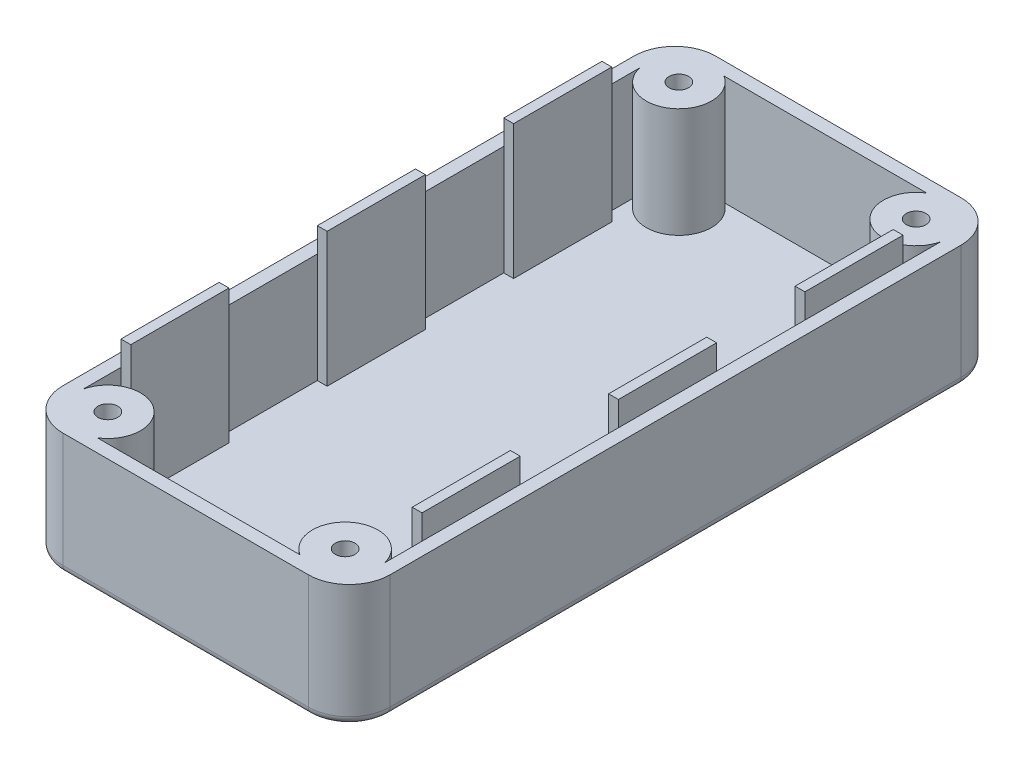
from build123d import *

# Parameters (mm, degrees)
BASE_SKETCH_W            = 40
BASE_SKETCH_H            = 79.79
BASE_DEPTH               = 15
CORNER_ROUNDS_R5_R       = 5
SHELL_T                  = -1.6
SKETCH2_R                = 4
SCREW_BOSSES_DEPTH       = 15
SKETCH3_W                = 1.2
SKETCH3_H                = 12
ALIGNMENT_TABS_DEPTH     = 18
BOTTOM_EDGE_ROUND_R1_R   = 1
SKETCH4_R                = 1.2
M2_CLEARANCE_HOLES_DEPTH = 92.051875961
SKETCH5_R                = 2.2
M2_COUNTERBORES_DEPTH    = 11


with BuildPart() as part:
    # Base Sketch → Base (new body)
    with BuildSketch(Plane(origin=(0, 0, 0), x_dir=(1, 0, 0), z_dir=(0, 1, 0))):
        with Locations((20, 39.895)):
            Rectangle(BASE_SKETCH_W, BASE_SKETCH_H)
    extrude(amount=BASE_DEPTH)

    # Corner Rounds R5
    corner_rounds_r5_edges = [part.edges().sort_by_distance(p)[0] for p in [
        (0, 7.5, -79.79),
        (40, 7.5, -79.79),
        (40, 7.5, 0),
        (0, 7.5, 0),
    ]]
    fillet(corner_rounds_r5_edges, radius=CORNER_ROUNDS_R5_R)

    # Shell
    shell_openings = [part.faces().sort_by_distance(p)[0] for p in [
        (20, 15, -39.895),
    ]]
    offset(amount=SHELL_T, openings=shell_openings, kind=Kind.INTERSECTION)

    # Sketch2 → Screw Bosses (add)
    with BuildSketch(Plane(origin=(0, 0, 0), x_dir=(1, 0, 0), z_dir=(0, 1, 0))):
        with Locations((5.5, 5)):
            Circle(SKETCH2_R)
        with Locations((34.5, 5)):
            Circle(SKETCH2_R)
        with Locations((5.5, 74.79)):
            Circle(SKETCH2_R)
        with Locations((34.5, 74.79)):
            Circle(SKETCH2_R)
    extrude(amount=SCREW_BOSSES_DEPTH)

    # Sketch3 → Alignment Tabs (add)
    with BuildSketch(Plane(origin=(0, 0, 0), x_dir=(1, 0, 0), z_dir=(0, 1, 0))):
        with Locations((2.2, 16.5)):
            Rectangle(SKETCH3_W, SKETCH3_H)
        with Locations((2.2, 40.5)):
            Rectangle(SKETCH3_W, SKETCH3_H)
        with Locations((2.2, 63.29)):
            Rectangle(SKETCH3_W, SKETCH3_H)
        with Locations((37.8, 16.5)):
            Rectangle(SKETCH3_W, SKETCH3_H)
        with Locations((37.8, 40.5)):
            Rectangle(SKETCH3_W, SKETCH3_H)
        with Locations((37.8, 63.29)):
            Rectangle(SKETCH3_W, SKETCH3_H)
    extrude(amount=ALIGNMENT_TABS_DEPTH)

    # Bottom Edge Round R1
    bottom_edge_round_r1_edges = [part.edges().sort_by_distance(p)[0] for p in [
        (1.464466094, 0, -1.464466094),
        (20, 0, 0),
        (38.535533906, 0, -1.464466094),
        (40, 0, -39.895),
        (38.535533906, 0, -78.325533906),
        (20, 0, -79.79),
        (1.464466094, 0, -78.325533906),
        (0, 0, -39.895),
    ]]
    fillet(bottom_edge_round_r1_edges, radius=BOTTOM_EDGE_ROUND_R1_R)

    # Sketch4 → M2 Clearance Holes (cut, through all)
    with BuildSketch(Plane(origin=(0, 0, 0), x_dir=(1, 0, 0), z_dir=(0, 1, 0))):
        with Locations((5.5, 5)):
            Circle(SKETCH4_R)
        with Locations((34.5, 5)):
            Circle(SKETCH4_R)
        with Locations((5.5, 74.79)):
            Circle(SKETCH4_R)
        with Locations((34.5, 74.79)):
            Circle(SKETCH4_R)
    extrude(amount=M2_CLEARANCE_HOLES_DEPTH, mode=Mode.SUBTRACT)

    # Sketch5 → M2 Counterbores (cut)
    with BuildSketch(Plane(origin=(0, 0, 0), x_dir=(1, 0, 0), z_dir=(0, 1, 0))):
        with Locations((5.5, 5)):
            Circle(SKETCH5_R)
        with Locations((34.5, 5)):
            Circle(SKETCH5_R)
        with Locations((5.5, 74.79)):
            Circle(SKETCH5_R)
        with Locations((34.5, 74.79)):
            Circle(SKETCH5_R)
    extrude(amount=M2_COUNTERBORES_DEPTH, mode=Mode.SUBTRACT)


solid = part.part
